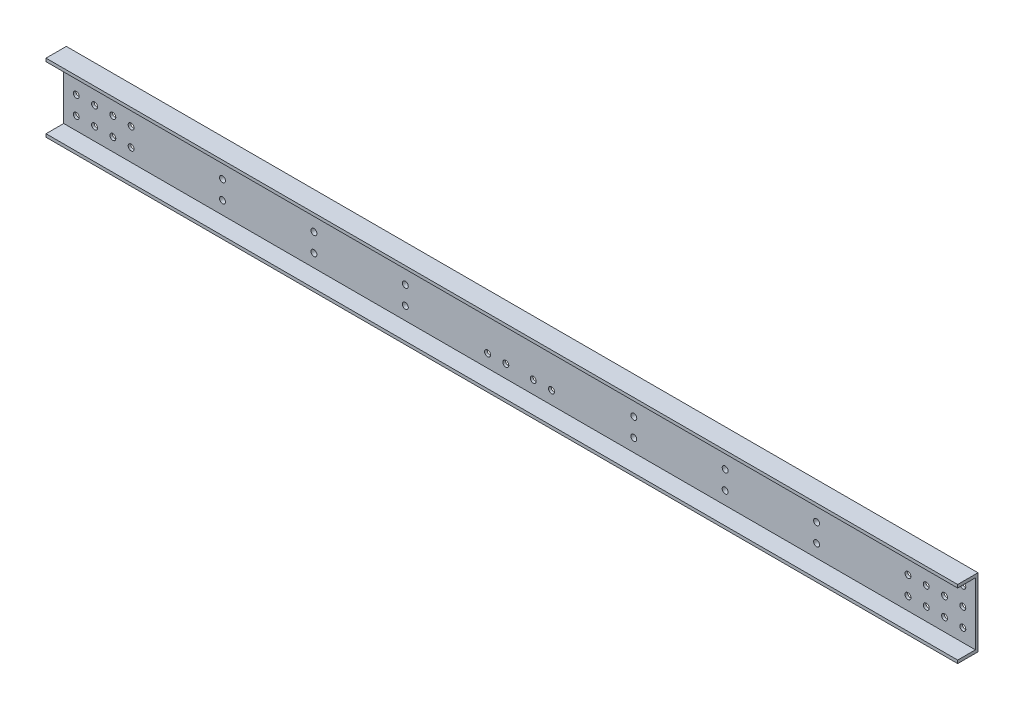
from build123d import *

# Parameters (mm, degrees)
SKETCH_1_W          = 3990
SKETCH_1_H          = 300
SKETCH_1_R          = 13
EXTRUDE_704_DEPTH   = 11.5
SKETCH_2_W          = 3990
SKETCH_2_H          = 13.5
EXTRUDE_1_DEPTH     = 77.5
SKETCH_3_W          = 70
SKETCH_3_H          = 230
EXTRUDE_2_DEPTH     = 16
SKETCH_4_R          = 13
CUT_EXTRUDE_1_DEPTH = 2004.38463606


with BuildPart() as part:
    # 草图1 → Extrude 704 (new body)
    with BuildSketch(Plane.XY):
        Rectangle(SKETCH_1_W, SKETCH_1_H)
        with Locations((1940, 0)):
            Circle(SKETCH_1_R, mode=Mode.SUBTRACT)
        with Locations((1860, 0)):
            Circle(SKETCH_1_R, mode=Mode.SUBTRACT)
        with Locations((1780, 0)):
            Circle(SKETCH_1_R, mode=Mode.SUBTRACT)
        with Locations((1700, 0)):
            Circle(SKETCH_1_R, mode=Mode.SUBTRACT)
        with Locations((1700, 80)):
            Circle(SKETCH_1_R, mode=Mode.SUBTRACT)
        with Locations((1780, 80)):
            Circle(SKETCH_1_R, mode=Mode.SUBTRACT)
        with Locations((1860, 80)):
            Circle(SKETCH_1_R, mode=Mode.SUBTRACT)
        with Locations((1940, 80)):
            Circle(SKETCH_1_R, mode=Mode.SUBTRACT)
        with Locations((1940, -80)):
            Circle(SKETCH_1_R, mode=Mode.SUBTRACT)
        with Locations((1860, -80)):
            Circle(SKETCH_1_R, mode=Mode.SUBTRACT)
        with Locations((1780, -80)):
            Circle(SKETCH_1_R, mode=Mode.SUBTRACT)
        with Locations((1700, -80)):
            Circle(SKETCH_1_R, mode=Mode.SUBTRACT)
        with Locations((-1700, -80)):
            Circle(SKETCH_1_R, mode=Mode.SUBTRACT)
        with Locations((-1780, -80)):
            Circle(SKETCH_1_R, mode=Mode.SUBTRACT)
        with Locations((-1860, -80)):
            Circle(SKETCH_1_R, mode=Mode.SUBTRACT)
        with Locations((-1940, -80)):
            Circle(SKETCH_1_R, mode=Mode.SUBTRACT)
        with Locations((-1940, 80)):
            Circle(SKETCH_1_R, mode=Mode.SUBTRACT)
        with Locations((-1860, 80)):
            Circle(SKETCH_1_R, mode=Mode.SUBTRACT)
        with Locations((-1780, 80)):
            Circle(SKETCH_1_R, mode=Mode.SUBTRACT)
        with Locations((-1700, 80)):
            Circle(SKETCH_1_R, mode=Mode.SUBTRACT)
        with Locations((-1700, 0)):
            Circle(SKETCH_1_R, mode=Mode.SUBTRACT)
        with Locations((-1780, 0)):
            Circle(SKETCH_1_R, mode=Mode.SUBTRACT)
        with Locations((-1860, 0)):
            Circle(SKETCH_1_R, mode=Mode.SUBTRACT)
        with Locations((-1940, 0)):
            Circle(SKETCH_1_R, mode=Mode.SUBTRACT)
        with Locations((60, 80)):
            Circle(SKETCH_1_R, mode=Mode.SUBTRACT)
        with Locations((140, 80)):
            Circle(SKETCH_1_R, mode=Mode.SUBTRACT)
        with Locations((140, -80)):
            Circle(SKETCH_1_R, mode=Mode.SUBTRACT)
        with Locations((60, -80)):
            Circle(SKETCH_1_R, mode=Mode.SUBTRACT)
        with Locations((-60, -80)):
            Circle(SKETCH_1_R, mode=Mode.SUBTRACT)
        with Locations((-140, -80)):
            Circle(SKETCH_1_R, mode=Mode.SUBTRACT)
        with Locations((-140, 80)):
            Circle(SKETCH_1_R, mode=Mode.SUBTRACT)
        with Locations((-60, 80)):
            Circle(SKETCH_1_R, mode=Mode.SUBTRACT)
    extrude(amount=EXTRUDE_704_DEPTH)

    # 草图2 → 凸台-拉伸1 (add)
    with BuildSketch(Plane.XY.offset(11.5)):
        with Locations((0, 143.25)):
            Rectangle(SKETCH_2_W, SKETCH_2_H)
        with Locations((0, -143.25)):
            Rectangle(SKETCH_2_W, SKETCH_2_H)
    extrude(amount=EXTRUDE_1_DEPTH)

    # 草图3 → 凸台-拉伸2 (add)
    with BuildSketch(Plane(origin=(0, 0, 0), x_dir=(-1, 0, 0), z_dir=(0, 0, -1))):
        with Locations((-1300, 0)):
            Rectangle(SKETCH_3_W, SKETCH_3_H)
        with Locations((-900, 0)):
            Rectangle(SKETCH_3_W, SKETCH_3_H)
        with Locations((-500, 0)):
            Rectangle(SKETCH_3_W, SKETCH_3_H)
        with Locations((500, 0)):
            Rectangle(SKETCH_3_W, SKETCH_3_H)
        with Locations((900, 0)):
            Rectangle(SKETCH_3_W, SKETCH_3_H)
        with Locations((1300, 0)):
            Rectangle(SKETCH_3_W, SKETCH_3_H)
    extrude(amount=EXTRUDE_2_DEPTH)

    # 草图4 → 切除-拉伸1 (cut, through all)
    with BuildSketch(Plane(origin=(0, 0, -16), x_dir=(-1, 0, 0), z_dir=(0, 0, -1))):
        with Locations((-1300, 0)):
            Circle(SKETCH_4_R)
        with Locations((-1300, 80)):
            Circle(SKETCH_4_R)
        with Locations((-900, 80)):
            Circle(SKETCH_4_R)
        with Locations((-900, 0)):
            Circle(SKETCH_4_R)
        with Locations((-500, 80)):
            Circle(SKETCH_4_R)
        with Locations((-500, 0)):
            Circle(SKETCH_4_R)
        with Locations((-500, -80)):
            Circle(SKETCH_4_R)
        with Locations((-900, -80)):
            Circle(SKETCH_4_R)
        with Locations((-1300, -80)):
            Circle(SKETCH_4_R)
        with Locations((1300, -80)):
            Circle(SKETCH_4_R)
        with Locations((900, -80)):
            Circle(SKETCH_4_R)
        with Locations((500, -80)):
            Circle(SKETCH_4_R)
        with Locations((500, 0)):
            Circle(SKETCH_4_R)
        with Locations((500, 80)):
            Circle(SKETCH_4_R)
        with Locations((900, 0)):
            Circle(SKETCH_4_R)
        with Locations((900, 80)):
            Circle(SKETCH_4_R)
        with Locations((1300, 80)):
            Circle(SKETCH_4_R)
        with Locations((1300, 0)):
            Circle(SKETCH_4_R)
    extrude(amount=-CUT_EXTRUDE_1_DEPTH, mode=Mode.SUBTRACT)


solid = part.part
